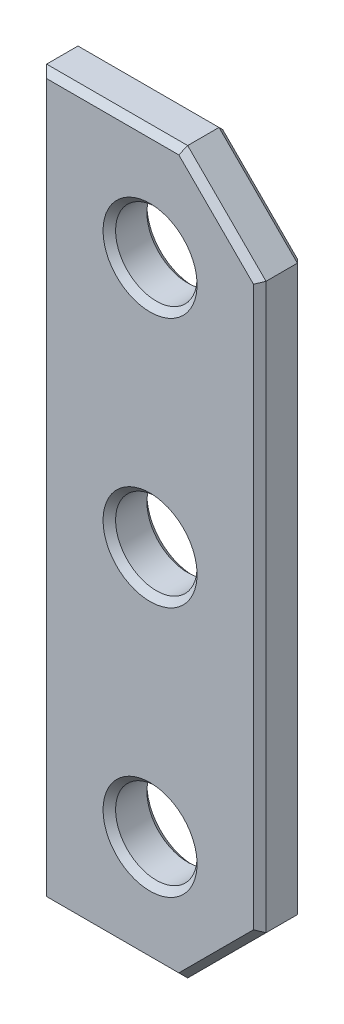
from build123d import *

# Parameters (mm, degrees)
SKETCH_1_R        = 13
EXTRUDE_436_DEPTH = 14
CHAMFER_1_SIZE    = 2


with BuildPart() as part:
    # 草图1 → Extrude 436 (new body)
    with BuildSketch(Plane.XY):
        Polygon((0, 0), (45, 0), (70, 25), (70, 205), (45, 230), (0, 230), align=None)
        with Locations((35, 35)):
            Circle(SKETCH_1_R, mode=Mode.SUBTRACT)
        with Locations((35, 115)):
            Circle(SKETCH_1_R, mode=Mode.SUBTRACT)
        with Locations((35, 195)):
            Circle(SKETCH_1_R, mode=Mode.SUBTRACT)
    extrude(amount=EXTRUDE_436_DEPTH)

    # 倒角1
    chamfer_1_edges = [part.edges().sort_by_distance(p)[0] for p in [
        (22, 195, 0),
        (22, 35, 0),
        (22.5, 0, 0),
        (57.5, 12.5, 0),
        (70, 115, 0),
        (57.5, 217.5, 0),
        (22.5, 230, 0),
        (0, 115, 0),
        (22, 115, 0),
        (22, 195, 14),
        (22, 35, 14),
        (22.5, 230, 14),
        (57.5, 217.5, 14),
        (70, 115, 14),
        (57.5, 12.5, 14),
        (22.5, 0, 14),
        (0, 115, 14),
        (22, 115, 14),
    ]]
    chamfer(chamfer_1_edges, length=CHAMFER_1_SIZE)


solid = part.part
